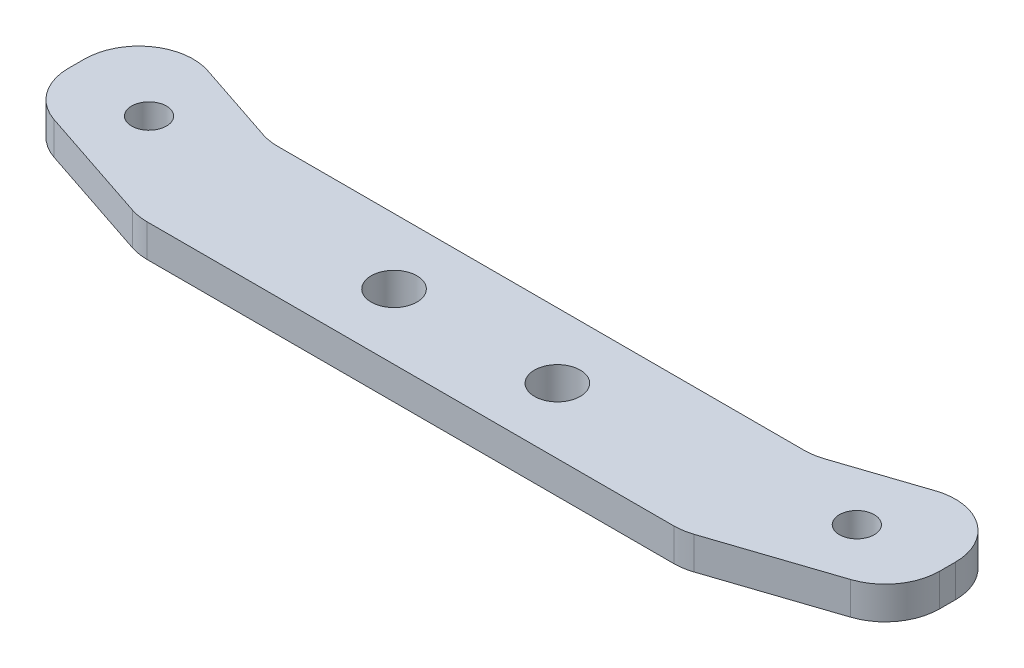
from build123d import *

# Parameters (mm, degrees)
SKETCH1_R           = 1.6
SKETCH1_R_2         = 2.1
BOSS_EXTRUDE1_DEPTH = 3
FILLET1_R           = 5


with BuildPart() as part:
    # Sketch1 → Boss-Extrude1 (new body)
    with BuildSketch(Plane(origin=(0, 0, 0), x_dir=(1, 0, 0), z_dir=(0, 1, 0))):
        Polygon((0, 0), (0, 12), (15, 7), (65, 7), (80, 12), (80, 0), (65, -5), (15, -5), align=None)
        with Locations((7.5, 3.5)):
            Circle(SKETCH1_R, mode=Mode.SUBTRACT)
        with Locations((32.5, 1)):
            Circle(SKETCH1_R_2, mode=Mode.SUBTRACT)
        with Locations((72.5, 3.5)):
            Circle(SKETCH1_R, mode=Mode.SUBTRACT)
        with Locations((47.5, 1)):
            Circle(SKETCH1_R_2, mode=Mode.SUBTRACT)
    extrude(amount=BOSS_EXTRUDE1_DEPTH)

    # Fillet1
    fillet1_edges = [part.edges().sort_by_distance(p)[0] for p in [
        (0, 1.5, 0),
        (15, 1.5, -7),
        (65, 1.5, -7),
        (80, 1.5, -12),
        (80, 1.5, 0),
        (65, 1.5, 5),
        (15, 1.5, 5),
        (0, 1.5, -12),
    ]]
    fillet(fillet1_edges, radius=FILLET1_R)


solid = part.part
